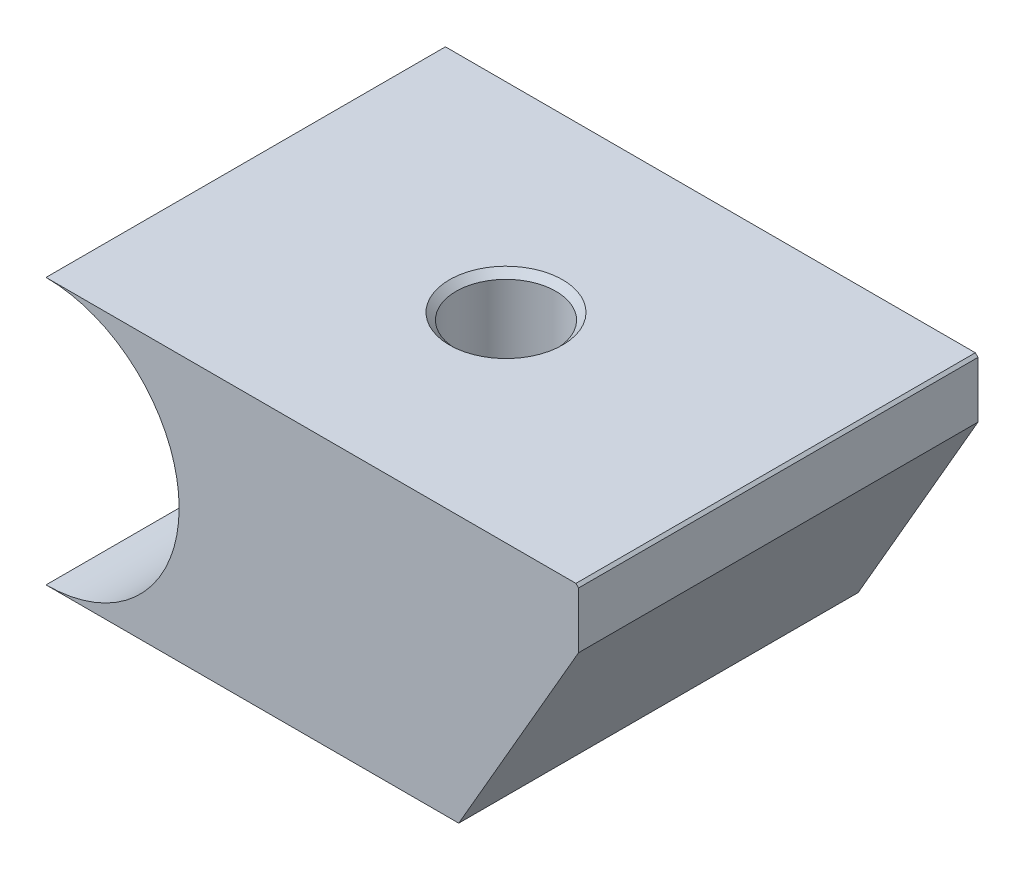
from build123d import *

# Parameters (mm, degrees)
BOSS_EXTRUDE1_DEPTH                    = 38.1
CHAMFER1_SIZE                          = 11.43
CHAMFER1_SIZE2                         = 19.797340731
F_3_8_0_375_DIAMETER_HOLE1_D           = 9.525
F_3_8_0_375_DIAMETER_HOLE1_CSINK_D     = 10.795
F_3_8_0_375_DIAMETER_HOLE1_CSINK_ANGLE = 90
CHAMFER2_SIZE                          = 0.254


with BuildPart() as part:
    # Sketch1 → Boss-Extrude1 (new body)
    with BuildSketch(Plane.XY):
        with BuildLine():
            Line((0, 0), (50.8, 0))
            Line((50.8, 0), (50.8, 25.4))
            Line((50.8, 25.4), (0, 25.4))
            ThreePointArc((0, 25.4), (12.7, 12.7), (0, 0))
        make_face()
    extrude(amount=BOSS_EXTRUDE1_DEPTH)

    # Chamfer1
    chamfer1_edges = [part.edges().sort_by_distance(p)[0] for p in [
        (50.8, 0, 19.05),
    ]]
    chamfer1_side = [part.faces().sort_by_distance(p)[0] for p in [
        (25.4, 0, 19.05),
    ]]
    chamfer(chamfer1_edges, length=CHAMFER1_SIZE, length2=CHAMFER1_SIZE2, reference=chamfer1_side[0])

    # 3/8 (0.375) Diameter Hole1 (through all)
    with Locations(Plane(origin=(0, 25.4, 0), x_dir=(1, 0, 0), z_dir=(0, 1, 0))):
        with Locations((24.8285, -19.05)):
            CounterSinkHole(F_3_8_0_375_DIAMETER_HOLE1_D / 2, F_3_8_0_375_DIAMETER_HOLE1_CSINK_D / 2, counter_sink_angle=F_3_8_0_375_DIAMETER_HOLE1_CSINK_ANGLE)

    # Chamfer2
    chamfer2_edges = [part.edges().sort_by_distance(p)[0] for p in [
        (50.8, 25.4, 19.05),
    ]]
    chamfer(chamfer2_edges, length=CHAMFER2_SIZE)


solid = part.part
